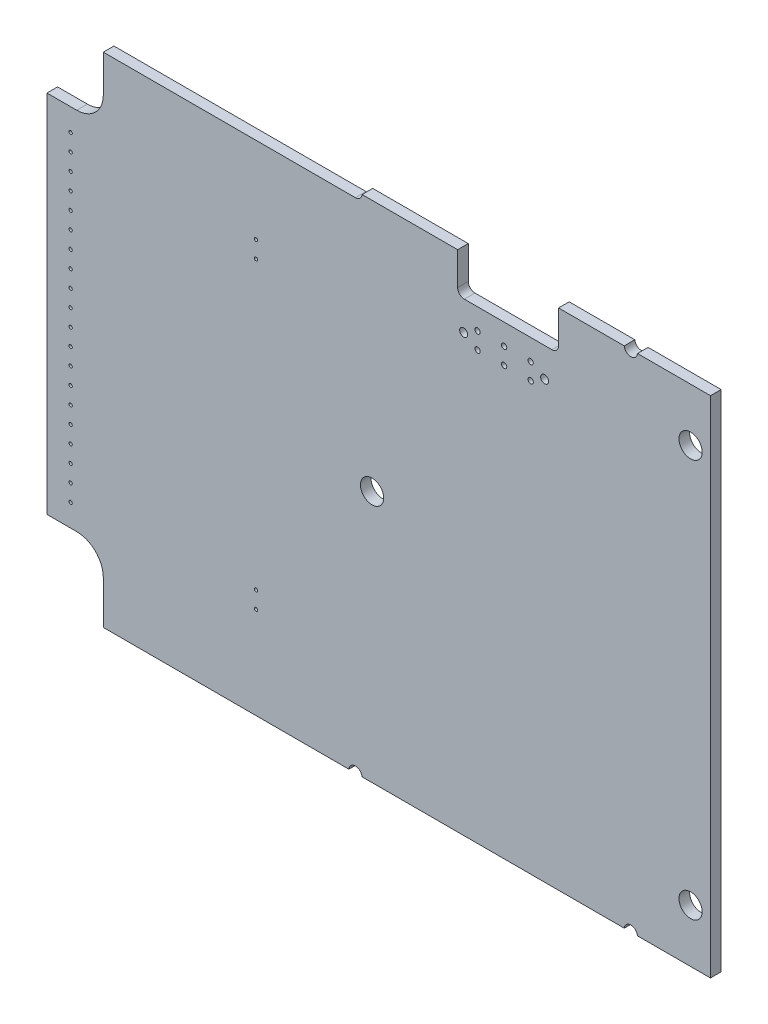
from build123d import *

# Parameters (mm, degrees)
BOSS_EXTRUDE1_DEPTH = 1.6
SKETCH4_R           = 4
SKETCH4_R_2         = 1.75
CUT_EXTRUDE1_DEPTH  = 400.067265686
SKETCH5_W           = 56.357034967
SKETCH5_H           = 93.472031877
CUT_EXTRUDE2_DEPTH  = 400.067265686
SKETCH6_R           = 0.25
CUT_EXTRUDE3_DEPTH  = 352.76617786
SKETCH7_R           = 0.4
SKETCH7_R_2         = 0.6
CUT_EXTRUDE4_DEPTH  = 352.76617786


with BuildPart() as part:
    # Sketch3 → Boss-Extrude1 (new body)
    with BuildSketch(Plane.XY):
        with BuildLine():
            Line((393.950402667, -4.822984295), (393.950402667, 56.183932476))
            ThreePointArc((393.950402667, 56.183932476), (393.033497857, 57.180474091), (393.950402667, 58.177015705))
            Line((393.950402667, 58.177015705), (393.950402667, 60.680474091))
            ThreePointArc((393.950402667, 60.680474091), (393.071723011, 62.801794434), (390.950402667, 63.680474091))
            Line((390.950402667, 63.680474091), (376.446944282, 63.680474091))
            ThreePointArc((376.446944282, 63.680474091), (375.450402667, 62.76356928), (374.453861053, 63.680474091))
            Line((374.453861053, 63.680474091), (334.946944282, 63.680474091))
            ThreePointArc((334.946944282, 63.680474091), (333.950402667, 62.76356928), (332.953861053, 63.680474091))
            Line((332.953861053, 63.680474091), (323.050402667, 63.680474091))
            Line((323.050402667, 63.680474091), (323.050402667, 58.730474091))
            ThreePointArc((323.050402667, 58.730474091), (322.757509449, 58.02336731), (322.050402667, 57.730474091))
            Line((322.050402667, 57.730474091), (308.850402667, 57.730474091))
            ThreePointArc((308.850402667, 57.730474091), (308.143295886, 58.02336731), (307.850402667, 58.730474091))
            Line((307.850402667, 58.730474091), (307.850402667, 63.680474091))
            Line((307.850402667, 63.680474091), (293.446944282, 63.680474091))
            ThreePointArc((293.446944282, 63.680474091), (293.381998301, 63.400072958), (293.239876352, 63.14978487))
            ThreePointArc((293.239876352, 63.14978487), (292.889842988, 62.865297492), (292.450402667, 62.76356928))
            Line((292.450402667, 62.76356928), (254.450402667, 62.76356928))
            Line((254.450402667, 62.76356928), (254.450402667, 57.180474091))
            ThreePointArc((254.450402667, 57.180474091), (253.278829792, 54.352046966), (250.450402667, 53.180474091))
            Line((250.450402667, 53.180474091), (245.950402667, 53.180474091))
            Line((245.950402667, 53.180474091), (245.950402667, -1.819525909))
            Line((245.950402667, -1.819525909), (250.450402667, -1.819525909))
            ThreePointArc((250.450402667, -1.819525909), (253.278829792, -2.991098784), (254.450402667, -5.819525909))
            Line((254.450402667, -5.819525909), (254.450402667, -12.319525909))
            Line((254.450402667, -12.319525909), (291.453861053, -12.319525909))
            ThreePointArc((291.453861053, -12.319525909), (292.450402667, -11.402621099), (293.446944282, -12.319525909))
            Line((293.446944282, -12.319525909), (332.953861053, -12.319525909))
            ThreePointArc((332.953861053, -12.319525909), (333.950402667, -11.402621099), (334.946944282, -12.319525909))
            Line((334.946944282, -12.319525909), (374.453861053, -12.319525909))
            ThreePointArc((374.453861053, -12.319525909), (375.450402667, -11.402621099), (376.446944282, -12.319525909))
            Line((376.446944282, -12.319525909), (390.950402667, -12.319525909))
            ThreePointArc((390.950402667, -12.319525909), (393.071723011, -11.440846253), (393.950402667, -9.319525909))
            Line((393.950402667, -9.319525909), (393.950402667, -6.816067524))
            ThreePointArc((393.950402667, -6.816067524), (393.033497857, -5.819525909), (393.950402667, -4.822984295))
        make_face()
    extrude(amount=BOSS_EXTRUDE1_DEPTH)

    # Sketch4 → Cut-Extrude1 (cut, through all)
    with BuildSketch(Plane.XY.offset(1.6)):
        with Locations((375.450402667, 57.180474091)):
            Circle(SKETCH4_R)
        with Locations((342.950402667, 55.680474091)):
            Circle(SKETCH4_R_2)
        with Locations((342.950402667, -4.319525909)):
            Circle(SKETCH4_R_2)
        with Locations((375.450402667, -5.819525909)):
            Circle(SKETCH4_R)
        with Locations((294.950402667, 25.680474091)):
            Circle(SKETCH4_R_2)
    extrude(amount=-CUT_EXTRUDE1_DEPTH, mode=Mode.SUBTRACT)

    # Sketch5 → Cut-Extrude2 (cut, through all)
    with BuildSketch(Plane.XY.offset(1.6)):
        with Locations((374.128920151, 24.161368201)):
            Rectangle(SKETCH5_W, SKETCH5_H)
    extrude(amount=-CUT_EXTRUDE2_DEPTH, mode=Mode.SUBTRACT)

    # Sketch6 → Cut-Extrude3 (cut, through all)
    with BuildSketch(Plane.XY.offset(1.6)):
        with Locations((249.525402667, 49.810474091)):
            Circle(SKETCH6_R)
        with Locations((277.465402667, 49.810474091)):
            Circle(SKETCH6_R)
        with Locations((277.465402667, 47.270474091)):
            Circle(SKETCH6_R)
        with Locations((277.465402667, 4.090474091)):
            Circle(SKETCH6_R)
        with Locations((277.465402667, 1.550474091)):
            Circle(SKETCH6_R)
        with Locations((249.525402667, 1.550474091)):
            Circle(SKETCH6_R)
        with Locations((249.525402667, 4.090474091)):
            Circle(SKETCH6_R)
        with Locations((249.525402667, 6.630474091)):
            Circle(SKETCH6_R)
        with Locations((249.525402667, 9.170474091)):
            Circle(SKETCH6_R)
        with Locations((249.525402667, 11.710474091)):
            Circle(SKETCH6_R)
        with Locations((249.525402667, 14.250474091)):
            Circle(SKETCH6_R)
        with Locations((249.525402667, 16.790474091)):
            Circle(SKETCH6_R)
        with Locations((249.525402667, 19.330474091)):
            Circle(SKETCH6_R)
        with Locations((249.525402667, 21.870474091)):
            Circle(SKETCH6_R)
        with Locations((249.525402667, 24.410474091)):
            Circle(SKETCH6_R)
        with Locations((249.525402667, 26.950474091)):
            Circle(SKETCH6_R)
        with Locations((249.525402667, 29.490474091)):
            Circle(SKETCH6_R)
        with Locations((249.525402667, 32.030474091)):
            Circle(SKETCH6_R)
        with Locations((249.525402667, 34.570474091)):
            Circle(SKETCH6_R)
        with Locations((249.525402667, 37.110474091)):
            Circle(SKETCH6_R)
        with Locations((249.525402667, 39.650474091)):
            Circle(SKETCH6_R)
        with Locations((249.525402667, 42.190474091)):
            Circle(SKETCH6_R)
        with Locations((249.525402667, 44.730474091)):
            Circle(SKETCH6_R)
        with Locations((249.525402667, 47.270474091)):
            Circle(SKETCH6_R)
    extrude(amount=-CUT_EXTRUDE3_DEPTH, mode=Mode.SUBTRACT)

    # Sketch7 → Cut-Extrude4 (cut, through all)
    with BuildSketch(Plane(origin=(0, 0, 0), x_dir=(-1, 0, 0), z_dir=(0, 0, -1))):
        with Locations((-310.850402667, 54.580474091)):
            Circle(SKETCH7_R)
        with Locations((-308.750402667, 53.330474091)):
            Circle(SKETCH7_R_2)
        with Locations((-314.850402667, 54.580474091)):
            Circle(SKETCH7_R)
        with Locations((-318.850402667, 54.580474091)):
            Circle(SKETCH7_R)
        with Locations((-314.850402667, 52.080474091)):
            Circle(SKETCH7_R)
        with Locations((-318.850402667, 52.080474091)):
            Circle(SKETCH7_R)
        with Locations((-310.850402667, 52.080474091)):
            Circle(SKETCH7_R)
        with Locations((-320.950402667, 53.330474091)):
            Circle(SKETCH7_R_2)
    extrude(amount=-CUT_EXTRUDE4_DEPTH, mode=Mode.SUBTRACT)


solid = part.part
